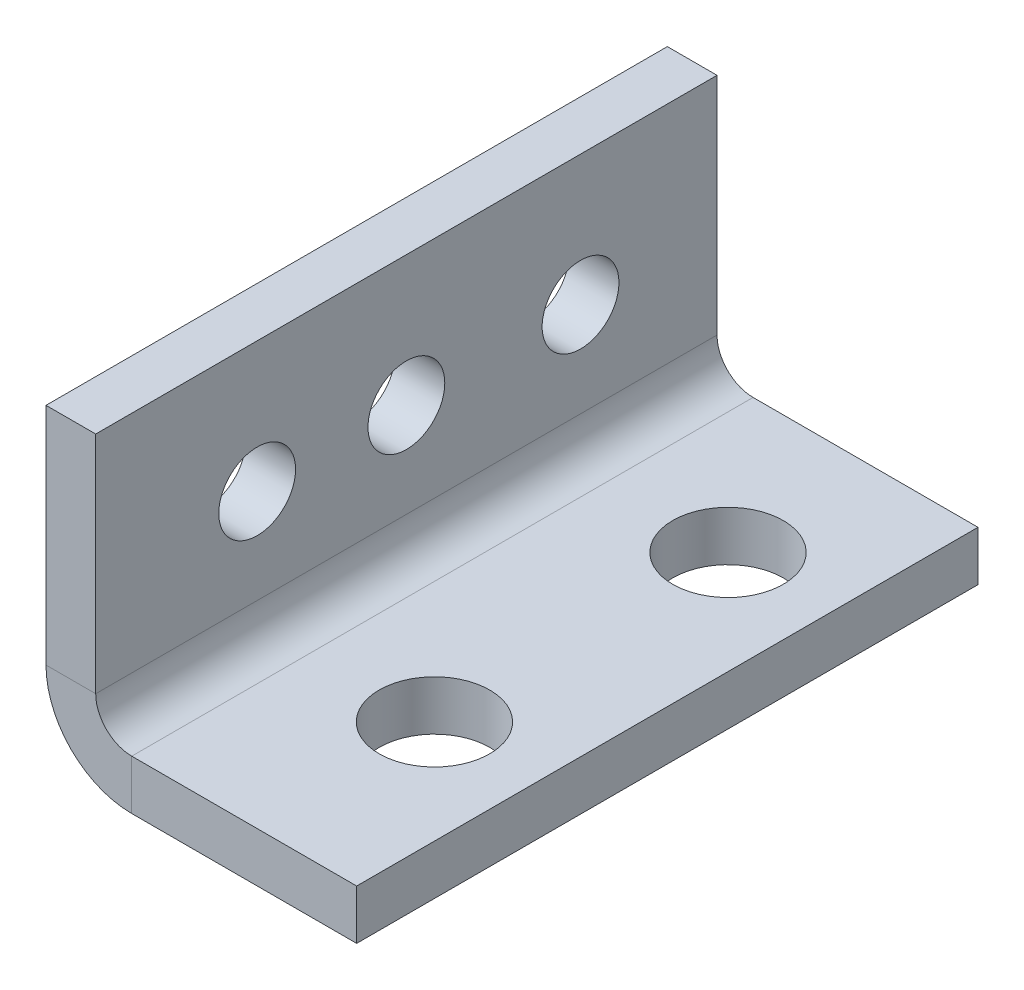
from build123d import *

# Parameters (mm, degrees)
SKETCH1_W                    = 12.7
SKETCH1_H                    = 6.35
SKETCH1_R                    = 0.785
BASE_FLANGE1_DEPTH           = 1.016
EDGE_FLANGE1_STRIP_W         = 5.5372
EDGE_FLANGE1_STRIP_H         = 1.016
EDGE_FLANGE1_STRIP_CUT_DEPTH = 12.7
EDGE_FLANGE1_DEPTH           = 12.7
CUT_EXTRUDE1_REACH           = 16.771
SKETCH9_R                    = 1.13


# Sheet-metal steps are written as plain solids
with BuildPart() as part:
    # Sketch1 → Base-Flange1 (new body)
    with BuildSketch(Plane(origin=(0, 0, 0), x_dir=(0, 0, -1), z_dir=(1, 0, 0))):
        with Locations((6.35, 3.175)):
            Rectangle(SKETCH1_W, SKETCH1_H)
        with Locations((3.3, 3.685)):
            Circle(SKETCH1_R, mode=Mode.SUBTRACT)
        with Locations((6.35, 3.685)):
            Circle(SKETCH1_R, mode=Mode.SUBTRACT)
        with Locations((9.91, 3.685)):
            Circle(SKETCH1_R, mode=Mode.SUBTRACT)
    extrude(amount=-BASE_FLANGE1_DEPTH)

    # Edge-Flange1 strip (across the edge) → Edge-Flange1 strip cut (cut)
    with BuildSketch(Plane.YX):
        with Locations((-1.016, -0.508)):
            Rectangle(EDGE_FLANGE1_STRIP_W, EDGE_FLANGE1_STRIP_H)
    extrude(amount=EDGE_FLANGE1_STRIP_CUT_DEPTH, mode=Mode.SUBTRACT)

    # Edge-Flange1 section (across the edge) → Edge-Flange1 (add)
    with BuildSketch(Plane.YX):
        with BuildLine():
            Line((0, 0.7366), (0, 5.334))
            Line((0, 5.334), (1.016, 5.334))
            Line((1.016, 5.334), (1.016, 0.7366))
            ThreePointArc((1.016, 0.7366), (1.231745145, 0.215745145), (1.7526, 0))
            Line((1.7526, 0), (1.7526, -1.016))
            ThreePointArc((1.7526, -1.016), (0.513324655, -0.502675345), (0, 0.7366))
        make_face()
    extrude(amount=EDGE_FLANGE1_DEPTH)

    # Sketch9 → Cut-Extrude1 (cut, up to next)
    with BuildSketch(Plane(origin=(0, 1.016, 0), x_dir=(1, 0, 0), z_dir=(0, 1, 0)), mode=Mode.PRIVATE) as cut_extrude1_sk1:
        with Locations(Location((3.224, 3.7, 0), (0, 0, 180))):
            Circle(SKETCH9_R)
    cut_extrude1_tool1 = extrude(cut_extrude1_sk1.sketch, amount=-CUT_EXTRUDE1_REACH, mode=Mode.PRIVATE) & part.part
    # Sketch9 → Cut-Extrude1 (cut, up to next)
    with BuildSketch(Plane(origin=(0, 1.016, 0), x_dir=(1, 0, 0), z_dir=(0, 1, 0)), mode=Mode.PRIVATE) as cut_extrude1_sk2:
        with Locations(Location((3.224, 9.7, 0), (0, 0, 180))):
            Circle(SKETCH9_R)
    cut_extrude1_tool2 = extrude(cut_extrude1_sk2.sketch, amount=-CUT_EXTRUDE1_REACH, mode=Mode.PRIVATE) & part.part
    add(cut_extrude1_tool1.solids().sort_by_distance((3.224, 1.016, -3.7))[0], mode=Mode.SUBTRACT)
    add(cut_extrude1_tool2.solids().sort_by_distance((3.224, 1.016, -9.7))[0], mode=Mode.SUBTRACT)


solid = part.part
